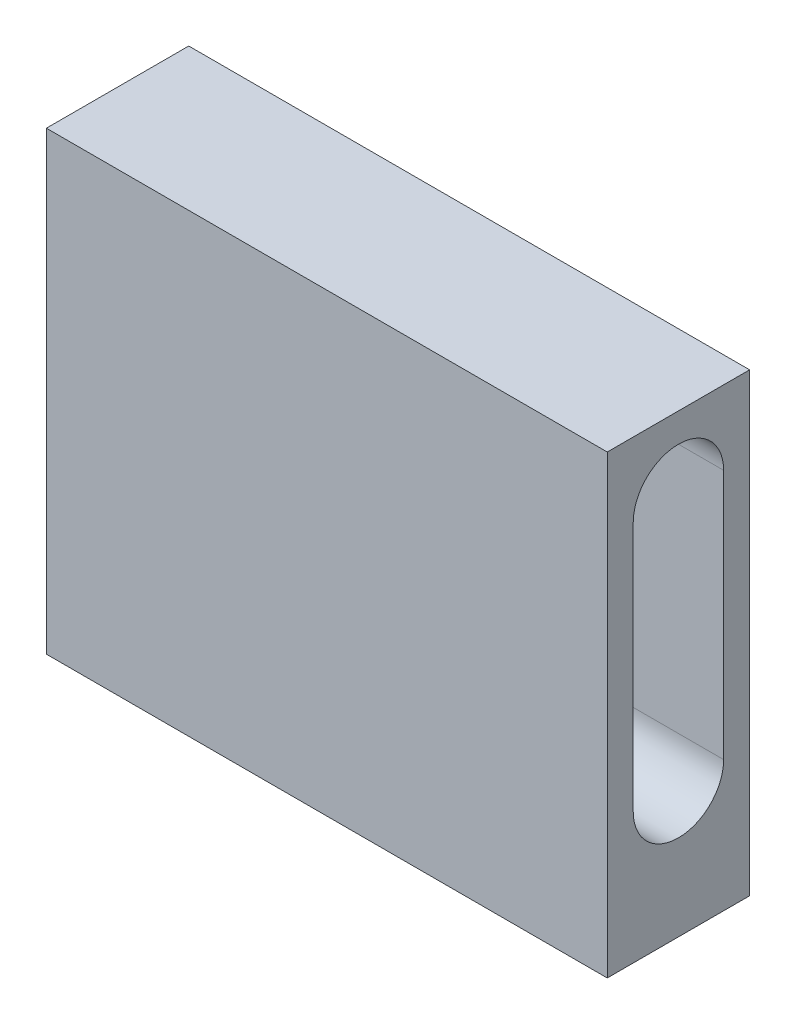
from build123d import *

# Parameters (mm, degrees)
SKETCH1_W           = 19.7
SKETCH1_H           = 5
BOSS_EXTRUDE1_DEPTH = 14
CUT_EXTRUDE1_DEPTH  = 4
SKETCH3_W           = 19.7
SKETCH3_H           = 5
BOSS_EXTRUDE2_DEPTH = 2


with BuildPart() as part:
    # Sketch1 → Boss-Extrude1 (new body)
    with BuildSketch(Plane(origin=(0, 0, 0), x_dir=(1, 0, 0), z_dir=(0, 1, 0))):
        Rectangle(SKETCH1_W, SKETCH1_H)
    extrude(amount=BOSS_EXTRUDE1_DEPTH)

    # Sketch2 → Cut-Extrude1 (cut)
    with BuildSketch(Plane(origin=(9.85, 0, 0), x_dir=(0, 0, -1), z_dir=(1, 0, 0))):
        with BuildLine():
            Line((-1.5875, 2.6), (-1.5875, 11.4))
            ThreePointArc((-1.5875, 11.4), (0, 12.9875), (1.5875, 11.4))
            Line((1.5875, 11.4), (1.5875, 2.6))
            ThreePointArc((1.5875, 2.6), (0, 1.0125), (-1.5875, 2.6))
        make_face()
    extrude(amount=-CUT_EXTRUDE1_DEPTH, mode=Mode.SUBTRACT)

    # Sketch3 → Boss-Extrude2 (add)
    with BuildSketch(Plane.XZ):
        Rectangle(SKETCH3_W, SKETCH3_H)
    extrude(amount=BOSS_EXTRUDE2_DEPTH)


solid = part.part
